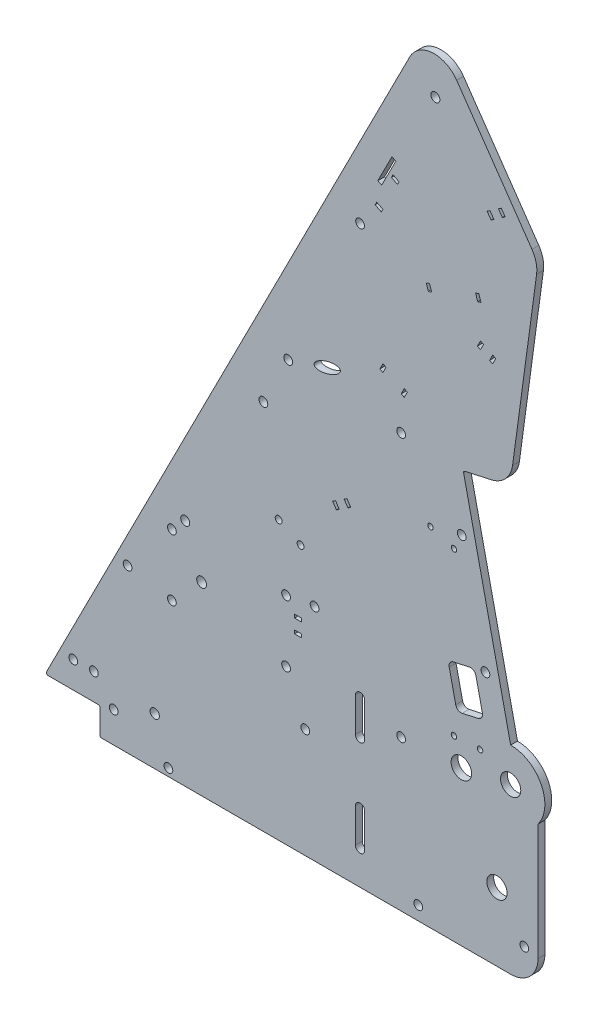
from build123d import *

# Parameters (mm, degrees)
BOSS_EXTRUDE1_DEPTH     = 3.175
SKETCH2_R               = 2.0955
SKETCH2_R_2             = 2.286
SKETCH2_R_3             = 2.032
SKETCH2_R_4             = 4.699
CUT_EXTRUDE1_DEPTH      = 421.976111717
SKETCH7_R               = 2.159
CUT_EXTRUDE2_DEPTH      = 421.976111717
CUT_EXTRUDE3_REACH      = 422.976
SKETCH10_R              = 2.032
FILLET1_R               = 12.7
FILLET2_R               = 0.79375
SKETCH12_R              = 2.032
CUT_EXTRUDE5_DEPTH      = 411.989226146
SKETCH13_R              = 2.032
SKETCH13_R_2            = 1.6
SKETCH13_RX             = 6.35
SKETCH13_RY             = 2.38125
SKETCH13_W              = 3.175
SKETCH13_H              = 1.5875
CUT_EXTRUDE6_DEPTH      = 411.989226146
CUT_EXTRUDE7_DEPTH      = 411.989226285
CUT_EXTRUDE7_DEPTH_BACK = 411.989226285
SKETCH14_R              = 1.27
SKETCH14_R_2            = 2.032
FILLET3_R               = 2.54
SKETCH15_R              = 4.7625
CUT_EXTRUDE8_DEPTH      = 411.989226285


with BuildPart() as part:
    # Sketch1 → Boss-Extrude1 (new body)
    with BuildSketch(Plane.XY):
        with BuildLine():
            Line((228.6, -12.7), (228.6, 53.975))
            ThreePointArc((228.6, 53.975), (230.099031657, 70.599515829), (215.9, 79.375))
            Line((215.9, 79.375), (193.909735224, 178.566674323))
            Line((193.909735224, 178.566674323), (215.607913982, 183.377044743))
            Line((215.607913982, 183.377044743), (228.6, 279.4))
            Line((228.6, 279.4), (178.754725958, 351.413083686))
            Line((178.754725958, 351.413083686), (0, 0))
            Line((0, 0), (25.4, 0))
            Line((25.4, 0), (25.4, -12.7))
            Line((25.4, -12.7), (228.6, -12.7))
        make_face()
    extrude(amount=BOSS_EXTRUDE1_DEPTH)

    # Sketch2 → Cut-Extrude1 (cut, through all)
    with BuildSketch(Plane.XY.offset(3.175)):
        with Locations((64.943150167, 94.057839899)):
            Circle(SKETCH2_R)
        with Locations((180.975, 322.164313376)):
            Circle(SKETCH2_R)
        with Locations((72.544547852, 73.173171402)):
            Circle(SKETCH2_R_2)
        with Locations((193.207821773, 152.394364194)):
            Circle(SKETCH2_R_3)
        with Locations((215.9, 63.5)):
            Circle(SKETCH2_R_4)
        with Locations((173.0375, -6.35)):
            Circle(SKETCH2_R_3)
        with Locations((204.202954161, 102.798527032)):
            Circle(SKETCH2_R_3)
        with Locations((209.55, 19.05)):
            Circle(SKETCH2_R_4)
        with Locations((165.1, 179.3875)):
            Circle(SKETCH2_R_3)
        with Locations((111.724047852, 87.460671402)):
            Circle(SKETCH2_R_3)
        with Locations((111.724047852, 58.885671402)):
            Circle(SKETCH2_R_3)
        with Locations((58.765047852, 58.885671402)):
            Circle(SKETCH2_R_3)
        with Locations((58.765047852, 87.460671402)):
            Circle(SKETCH2_R_3)
    extrude(amount=-CUT_EXTRUDE1_DEPTH, mode=Mode.SUBTRACT)

    # Sketch7 → Cut-Extrude2 (cut, through all)
    with BuildSketch(Plane.XY.offset(3.175)):
        with Locations((50.8, 9.525)):
            Circle(SKETCH7_R)
        with BuildLine():
            Line((143.891, 3.175), (143.891, 19.05))
            ThreePointArc((143.891, 19.05), (146.05, 21.209), (148.209, 19.05))
            Line((148.209, 19.05), (148.209, 3.175))
            ThreePointArc((148.209, 3.175), (146.05, 1.016), (143.891, 3.175))
        make_face()
        with BuildLine():
            Line((143.891, 47.625), (143.891, 63.5))
            ThreePointArc((143.891, 63.5), (146.05, 65.659), (148.209, 63.5))
            Line((148.209, 63.5), (148.209, 47.625))
            ThreePointArc((148.209, 47.625), (146.05, 45.466), (143.891, 47.625))
        make_face()
    extrude(amount=-CUT_EXTRUDE2_DEPTH, mode=Mode.SUBTRACT)

    # Sketch10 → Cut-Extrude3 (cut, up to next)
    with BuildSketch(Plane.XY.offset(3.175), mode=Mode.PRIVATE) as cut_extrude3_sk1:
        with Locations((120.65, 38.1)):
            Circle(SKETCH10_R)
    cut_extrude3_tool1 = extrude(cut_extrude3_sk1.sketch, amount=-CUT_EXTRUDE3_REACH, mode=Mode.PRIVATE) & part.part
    # Sketch10 → Cut-Extrude3 (cut, up to next)
    with BuildSketch(Plane.XY.offset(3.175), mode=Mode.PRIVATE) as cut_extrude3_sk2:
        with Locations((165.1, 57.15)):
            Circle(SKETCH10_R)
    cut_extrude3_tool2 = extrude(cut_extrude3_sk2.sketch, amount=-CUT_EXTRUDE3_REACH, mode=Mode.PRIVATE) & part.part
    # Sketch10 → Cut-Extrude3 (cut, up to next)
    with BuildSketch(Plane.XY.offset(3.175), mode=Mode.PRIVATE) as cut_extrude3_sk3:
        with Locations((13.046467246, 12.334704411)):
            Circle(SKETCH10_R)
    cut_extrude3_tool3 = extrude(cut_extrude3_sk3.sketch, amount=-CUT_EXTRUDE3_REACH, mode=Mode.PRIVATE) & part.part
    # Sketch10 → Cut-Extrude3 (cut, up to next)
    with BuildSketch(Plane.XY.offset(3.175), mode=Mode.PRIVATE) as cut_extrude3_sk4:
        with Locations((22.571467246, 12.334704411)):
            Circle(SKETCH10_R)
    cut_extrude3_tool4 = extrude(cut_extrude3_sk4.sketch, amount=-CUT_EXTRUDE3_REACH, mode=Mode.PRIVATE) & part.part
    # Sketch10 → Cut-Extrude3 (cut, up to next)
    with BuildSketch(Plane.XY.offset(3.175), mode=Mode.PRIVATE) as cut_extrude3_sk5:
        with Locations((38.211447917, 62.639810909)):
            Circle(SKETCH10_R)
    cut_extrude3_tool5 = extrude(cut_extrude3_sk5.sketch, amount=-CUT_EXTRUDE3_REACH, mode=Mode.PRIVATE) & part.part
    add(cut_extrude3_tool1.solids().sort_by_distance((120.65, 38.1, 3.175))[0], mode=Mode.SUBTRACT)
    add(cut_extrude3_tool2.solids().sort_by_distance((165.1, 57.15, 3.175))[0], mode=Mode.SUBTRACT)
    add(cut_extrude3_tool3.solids().sort_by_distance((13.046467, 12.334704, 3.175))[0], mode=Mode.SUBTRACT)
    add(cut_extrude3_tool4.solids().sort_by_distance((22.571467, 12.334704, 3.175))[0], mode=Mode.SUBTRACT)
    add(cut_extrude3_tool5.solids().sort_by_distance((38.211448, 62.639811, 3.175))[0], mode=Mode.SUBTRACT)

    # Fillet1
    fillet1_edges = [part.edges().sort_by_distance(p)[0] for p in [
        (228.6, -12.7, 1.5875),
        (178.754725958, 351.413083686, 1.5875),
        (215.607913982, 183.377044743, 1.5875),
        (228.6, 279.4, 1.5875),
    ]]
    fillet(fillet1_edges, radius=FILLET1_R)

    # Fillet2
    fillet2_edges = [part.edges().sort_by_distance(p)[0] for p in [
        (25.4, -12.7, 1.5875),
        (25.4, 0, 1.5875),
        (193.909735224, 178.566674323, 1.5875),
        (0, 0, 1.5875),
    ]]
    fillet(fillet2_edges, radius=FILLET2_R)

    # Sketch12 → Cut-Extrude5 (cut, through all)
    with BuildSketch(Plane.XY.offset(3.175)):
        with Locations((31.75, 1.5875)):
            Circle(SKETCH12_R)
        with Locations((173.0375, -6.35)):
            Circle(SKETCH12_R)
        with Locations((222.25, 1.5875)):
            Circle(SKETCH12_R)
        with Locations((57.15, -9.2075)):
            Circle(SKETCH12_R)
    extrude(amount=-CUT_EXTRUDE5_DEPTH, mode=Mode.SUBTRACT)

    # Sketch13 → Cut-Extrude6 (cut, through all)
    with BuildSketch(Plane.XY.offset(3.175)):
        with Locations((112.7125, 182.5625)):
            Circle(SKETCH13_R)
        with Locations((146.05, 254)):
            Circle(SKETCH13_R)
        with Locations((101.196445848, 159.923142748)):
            Circle(SKETCH13_R)
        with Locations((-8.840164817, -85.532391258)):
            Circle(SKETCH13_R_2)
        with Locations((-3.671542088, -75.371419893)):
            Circle(SKETCH13_R_2)
        with Locations((108.294003262, 116.150198589)):
            Circle(SKETCH13_R_2)
        with Locations((118.454974627, 110.981575859)):
            Circle(SKETCH13_R_2)
        with Locations(Location((130.826142263, 188.461522288), (0, 0, 18.038739462))):
            Ellipse(SKETCH13_RX, SKETCH13_RY)
        Polygon((178.26972852, 245.992253978), (176.758236028, 245.506922447), (177.728899089, 242.483937462), (179.240391581, 242.969268992), align=None)
        Polygon((160.847712251, 288.198438198), (154.283561384, 275.294004564), (156.066187939, 274.387228647), (162.630338806, 287.29166228), align=None)
        Polygon((200.609634347, 249.830809719), (202.12112684, 250.316141249), (201.150463779, 253.339126235), (199.638971286, 252.853794704), align=None)
        Polygon((160.590482388, 279.78010172), (163.420402045, 278.340594951), (164.140155429, 279.75555478), (161.310235773, 281.195061549), align=None)
        Polygon((153.789663007, 266.410402556), (153.069909623, 264.995442728), (155.899829279, 263.555935959), (156.619582664, 264.970895787), align=None)
        Polygon((203.330342332, 234.029927366), (201.915382504, 234.74968075), (200.475875735, 231.919761094), (201.890835563, 231.200007709), align=None)
        Polygon((206.135715047, 229.040747556), (207.550674876, 228.320994171), (208.990181645, 231.150913828), (207.575221816, 231.870667212), align=None)
        Polygon((211.540543439, 292.889033628), (210.235229039, 291.98553456), (212.042227175, 289.374905759), (213.347541575, 290.278404827), align=None)
        Polygon((206.319285837, 289.275037356), (205.013971437, 288.371538288), (206.820969573, 285.760909487), (208.126283974, 286.664408555), align=None)
        Polygon((133.35043444, 136.102010662), (135.081463368, 133.440401403), (136.412267998, 134.305915867), (134.681239069, 136.967525126), align=None)
        Polygon((155.228084113, 200.119678264), (156.643043941, 199.39992488), (158.08255071, 202.229844536), (156.667590882, 202.949597921), align=None)
        Polygon((165.132802911, 195.081404573), (166.547762739, 194.361651188), (167.987269508, 197.191570845), (166.57230968, 197.911324229), align=None)
        Polygon((140.404681887, 136.90245926), (138.673652958, 139.564068519), (140.004457588, 140.429582984), (141.735486516, 137.767973724), align=None)
        with Locations((117.248547852, 81.078921402)):
            Rectangle(SKETCH13_W, SKETCH13_H)
        with Locations((117.248547852, 74.728921402)):
            Rectangle(SKETCH13_W, SKETCH13_H)
    extrude(amount=-CUT_EXTRUDE6_DEPTH, mode=Mode.SUBTRACT)

    # Sketch14 → Cut-Extrude7 (cut, two sides: drawn at the far end of the back side and taken through both)
    with BuildSketch(Plane.XY.offset(3.175).offset(-CUT_EXTRUDE7_DEPTH_BACK)):
        with Locations((189.602197334, 69.980636704)):
            Circle(SKETCH14_R)
        with Locations((201.708862449, 70.509225118)):
            Circle(SKETCH14_R)
        with Locations((165.1, 57.15)):
            Circle(SKETCH14_R_2)
        with Locations((124.949053947, 89.585206774)):
            Circle(SKETCH14_R_2)
        with Locations((178.721644858, 148.532438598)):
            Circle(SKETCH14_R)
        with Locations((189.622629605, 145.09537131)):
            Circle(SKETCH14_R)
        Polygon((186.844411154, 98.950230697), (199.243370445, 101.699013794), (203.36654509, 83.100574858), (190.9675858, 80.351791761), align=None)
    extrude(amount=CUT_EXTRUDE7_DEPTH + CUT_EXTRUDE7_DEPTH_BACK, mode=Mode.SUBTRACT)

    # Fillet3
    fillet3_edges = [part.edges().sort_by_distance(p)[0] for p in [
        (199.243370445, 101.699013794, 1.5875),
        (186.844411154, 98.950230697, 1.5875),
        (190.9675858, 80.351791761, 1.5875),
        (203.36654509, 83.100574858, 1.5875),
    ]]
    fillet(fillet3_edges, radius=FILLET3_R)

    # Sketch15 → Cut-Extrude8 (cut, through all)
    with BuildSketch(Plane.XY.offset(3.175)):
        with Locations((193.04, 58.801)):
            Circle(SKETCH15_R)
    extrude(amount=-CUT_EXTRUDE8_DEPTH, mode=Mode.SUBTRACT)


solid = part.part
